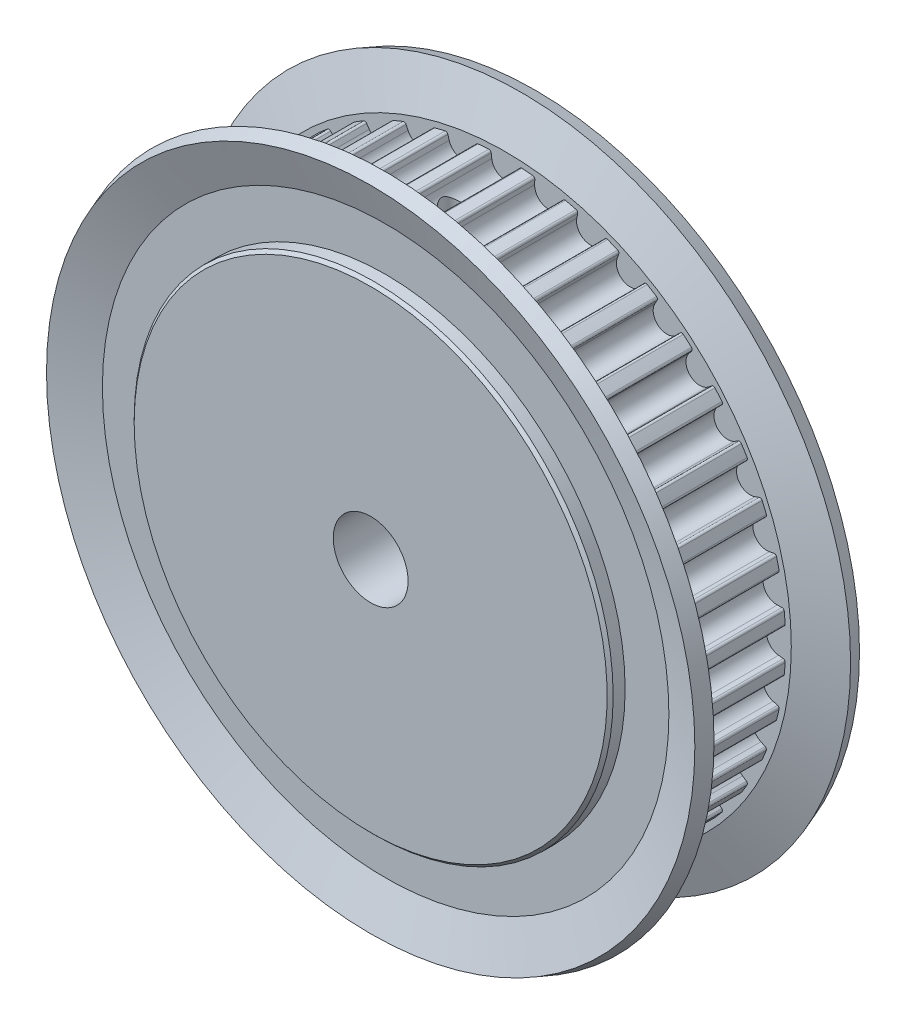
from build123d import *
from OCP.BRepAlgoAPI import BRepAlgoAPI_Cut
from OCP.TopTools import TopTools_ListOfShape
from build123d.topology import SkipClean

# Parameters (mm, degrees)
CUT_EXTRUDE_START            = 3.5
CUT_EXTRUDE_1_DEPTH          = 7
PATTERN_CIRCULAR_1_COUNT     = 40
CUT_EXTRUDE_START_2          = -5.5
CUT_EXTRUDE_N_DEPTH          = 11
EXTRUDE_START                = -5.5
EXTRUDE_P_DEPTH              = 11
CUT_EXTRUDE_1_2_REACH        = 33.595
CUT_EXTRUDE_1_2_END_RADIUS   = 0.918934444
SKETCH_7_R                   = 0.75
PATTERN_START                = 2.384847903
PATTERN_CIRCULAR_2_OUTLINE_R = 0.75
PATTERN_CIRCULAR_2_DEPTH     = 16.334712926
CHAMFER_1_SIZE               = 0.2


with BuildPart() as part:
    # 草图3 → 旋转1 (revolve)
    with BuildSketch(Plane(origin=(0, 0, 0), x_dir=(0, 0, -1), z_dir=(1, 0, 0)), mode=Mode.PRIVATE) as revolve_1_sk:
        Polygon((-5.5, 16), (-5.5, 0), (5.5, 0), (5.5, 16), (4.5, 16), (4.5, 18.92283325), (5.5, 21.656449872), (4.56086566, 22), (3.5, 19.1), (3.5, 18.72), (-3.5, 18.72), (-3.5, 19.1), (-4.56086566, 22), (-5.5, 21.656449872), (-4.5, 18.92283325), (-4.5, 16), align=None)
    revolve(revolve_1_sk.sketch.rotate(Axis((0, 0, 34.781081475), (0, 0, -1)), 90), axis=Axis((0, 0, 34.781081475), (0, 0, -1)))

    # 草图4 → Cut-Extrude 1 (cut)
    with BuildSketch(Plane.XY.offset(CUT_EXTRUDE_START)):
        with BuildLine():
            Line((-0.912084846, 18.246944507), (-0.95, 18.555738656))
            ThreePointArc((-0.95, 18.555738656), (-1.002857892, 18.65269447), (-1.10775819, 18.687195397))
            ThreePointArc((-1.10775819, 18.687195397), (0, 18.72), (1.10775819, 18.687195397))
            ThreePointArc((1.10775819, 18.687195397), (1.002857892, 18.65269447), (0.95, 18.555738656))
            Line((0.95, 18.555738656), (0.912084846, 18.246944507))
            ThreePointArc((0.912084846, 18.246944507), (0, 17.44), (-0.912084846, 18.246944507))
        make_face()
    cut_extrude_1 = extrude(amount=-CUT_EXTRUDE_1_DEPTH, mode=Mode.SUBTRACT)

    # 阵列(圆周)1: Cut-Extrude 1 ×40 about axis
    pattern_circular_1_axis = Axis((0, 0, 0), (0, 0, 1))
    for i in range(1, PATTERN_CIRCULAR_1_COUNT):
        add(cut_extrude_1.rotate(pattern_circular_1_axis, i * 360 / PATTERN_CIRCULAR_1_COUNT), mode=Mode.SUBTRACT)

    # 草图6 → N (cut)
    with BuildSketch(Plane.XY.offset(CUT_EXTRUDE_START_2)):
        with BuildLine():
            Line((-1.5, 3.9), (1.5, 3.9))
            Line((1.5, 3.9), (1.5, 2))
            ThreePointArc((1.5, 2), (0, -2.5), (-1.5, 2))
            Line((-1.5, 2), (-1.5, 3.9))
        make_face()
    extrude(amount=CUT_EXTRUDE_N_DEPTH, mode=Mode.SUBTRACT)

    # 草图8 → P (add)
    with SkipClean():  # the faces are left unmerged after this step: merging them gives an invalid solid
        with BuildSketch(Plane.XY.offset(EXTRUDE_START)):
            with BuildLine():
                Line((-1.5, 2), (-1.5, 3.9))
                Line((-1.5, 3.9), (1.5, 3.9))
                Line((1.5, 3.9), (1.5, 2))
                ThreePointArc((1.5, 2), (0, 2.5), (-1.5, 2))
            make_face()
        extrude(amount=EXTRUDE_P_DEPTH)

    # Cut-Extrude 1 2: up to this cylinder (the profile starts outside it)
    with SkipClean():  # the faces are left unmerged after this step: merging them gives an invalid solid
        cut_extrude_1_2_end = Plane(origin=(0, 18.358934444, 0), z_dir=(0, 0, -1)) * Cylinder(CUT_EXTRUDE_1_2_END_RADIUS, 70.027868888, mode=Mode.PRIVATE)
        # 草图7 → Cut-Extrude 1 2 (cut, up to the surface)
        with BuildSketch(Plane(origin=(0, 0, 0), x_dir=(1, 0, 0), z_dir=(0, 1, 0)), mode=Mode.PRIVATE) as cut_extrude_1_2_sk1:
            with Locations(Location((0, 0, 0), (0, 0, 90))):
                Circle(SKETCH_7_R)
        cut_extrude_1_2_tool1 = extrude(cut_extrude_1_2_sk1.sketch, amount=CUT_EXTRUDE_1_2_REACH, mode=Mode.PRIVATE) - cut_extrude_1_2_end
        add(cut_extrude_1_2_tool1.solids().sort_by_distance((0, 0, 0))[0], mode=Mode.SUBTRACT)


with BuildPart() as pattern_circular_2_tool:
    # 螺纹孔2: read off the stored shape, not the designer's step
    # 螺纹孔2 outline → 螺纹孔2 (new body)
    with BuildSketch(Plane(origin=(0, 0, 0), x_dir=(0.500000000000004, 0.8660254037844363, 0), z_dir=(0.8660254037844363, -0.5000000000000042, 0)).offset(PATTERN_START)):
        Circle(PATTERN_CIRCULAR_2_OUTLINE_R)
    extrude(amount=PATTERN_CIRCULAR_2_DEPTH)


with BuildPart() as part_1:
    add(part.part)

    # 螺纹孔2: cut by pattern_circular_2_tool, with a tolerance
    pattern_circular_2_stock = TopTools_ListOfShape()
    pattern_circular_2_stock.Append(part_1.part.wrapped)
    pattern_circular_2_tools = TopTools_ListOfShape()
    pattern_circular_2_tools.Append(pattern_circular_2_tool.part.wrapped)
    pattern_circular_2_cut = BRepAlgoAPI_Cut()
    pattern_circular_2_cut.SetArguments(pattern_circular_2_stock)
    pattern_circular_2_cut.SetTools(pattern_circular_2_tools)
    pattern_circular_2_cut.SetFuzzyValue(0.00001)
    pattern_circular_2_cut.Build()
    add(Compound.cast(pattern_circular_2_cut.Shape()).solids(), mode=Mode.REPLACE)

    # 倒角1
    chamfer_1_edges = [part_1.edges().sort_by_distance(p)[0] for p in [
        (-16, 0, -5.5),
        (-16, 0, 5.5),
    ]]
    chamfer(chamfer_1_edges, length=CHAMFER_1_SIZE)


solid = part_1.part
